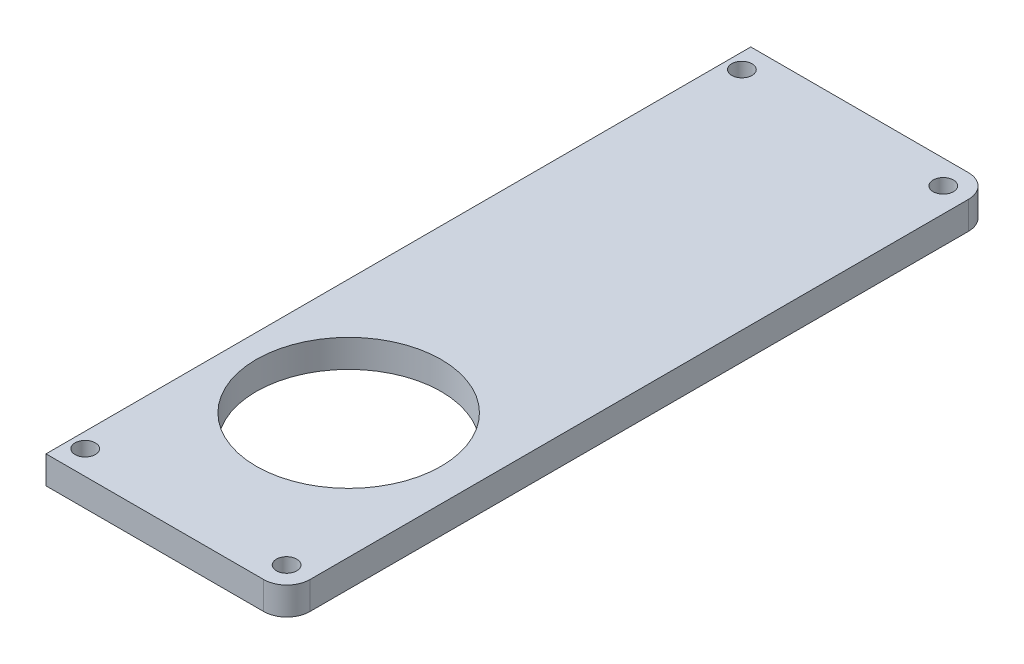
from build123d import *

# Parameters (mm, degrees)
SKETCH1_R           = 1.1
SKETCH1_R_2         = 10
BOSS_EXTRUDE1_DEPTH = 3


with BuildPart() as part:
    # Sketch1 → Boss-Extrude1 (new body)
    with BuildSketch(Plane(origin=(0, 0, 0), x_dir=(1, 0, 0), z_dir=(0, 1, 0))):
        with BuildLine():
            Line((-13.01875, -38.1), (10.51875, -38.1))
            ThreePointArc((10.51875, -38.1), (12.286516953, -37.367766953), (13.01875, -35.6))
            Line((13.01875, -35.6), (13.01875, 35.6))
            ThreePointArc((13.01875, 35.6), (12.286516953, 37.367766953), (10.51875, 38.1))
            Line((10.51875, 38.1), (-13.01875, 38.1))
            Line((-13.01875, 38.1), (-13.01875, -38.1))
        make_face()
        with Locations((-11.38125, 35.5)):
            Circle(SKETCH1_R, mode=Mode.SUBTRACT)
        with Locations((10.39375, 35.5)):
            Circle(SKETCH1_R, mode=Mode.SUBTRACT)
        with Locations((-11.38125, -35.5)):
            Circle(SKETCH1_R, mode=Mode.SUBTRACT)
        with Locations((10.39375, -35.5)):
            Circle(SKETCH1_R, mode=Mode.SUBTRACT)
        with Locations((-0.49375, -17.9)):
            Circle(SKETCH1_R_2, mode=Mode.SUBTRACT)
    extrude(amount=BOSS_EXTRUDE1_DEPTH)


solid = part.part
